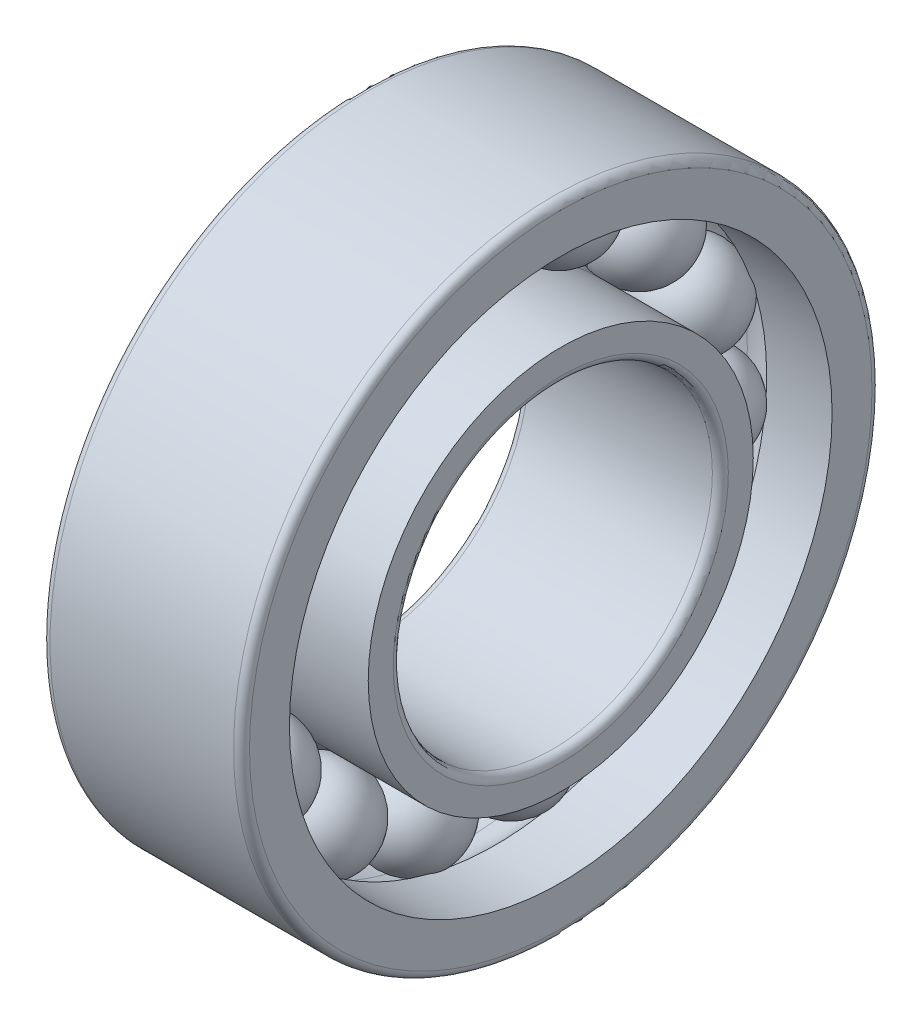
from build123d import *

# Parameters (mm, degrees)
CAGSPISKE_W         = 0.6
CAGSPISKE_H         = 0.4
CAGESPINE_ANGLE     = 0.001
BALLSDETAILED_COUNT = 15
BALLSDETAILED_ANGLE = 336


with BuildPart() as part:
    # CagSpiSke → CageSpine (revolve)
    with BuildSketch(Plane.XY):
        with Locations((0, 6)):
            Rectangle(CAGSPISKE_W, CAGSPISKE_H)
    revolve(axis=Axis((-20.6375, 0, 0), (1, 0, 0)), revolution_arc=CAGESPINE_ANGLE)

    # BalDetSke → BallDetailed (revolve)
    with BuildSketch(Plane.XY):
        with BuildLine():
            Line((-1.2, 6), (1.2, 6))
            ThreePointArc((1.2, 6), (0, 4.8), (-1.2, 6))
        make_face()
    balldetailed = revolve(axis=Axis((-1.905, 6, 0), (1, 0, 0)))

    # InnRacSke → InnerRace (revolve)
    with BuildSketch(Plane.XY):
        with BuildLine():
            Line((-0.860595724, 5.2), (-2.5, 5.2))
            Line((-2.5, 5.2), (-2.5, 4.2))
            ThreePointArc((-2.5, 4.2), (-2.441421356, 4.058578644), (-2.3, 4))
            Line((-2.3, 4), (2.3, 4))
            ThreePointArc((2.3, 4), (2.441421356, 4.058578644), (2.5, 4.2))
            Line((2.5, 4.2), (2.5, 4.825))
            Line((2.5, 4.825), (0, 4.825))
            ThreePointArc((0, 4.825), (-0.469374584, 4.922821974), (-0.860595724, 5.2))
        make_face()
    revolve(axis=Axis((-20.6375, 0, 0), (1, 0, 0)))

    # OutRacSke → OuterRace (revolve)
    with BuildSketch(Plane.XY):
        with BuildLine():
            Line((0, 7.175), (-2.5, 7.175))
            Line((-2.5, 7.175), (-2.5, 7.8))
            ThreePointArc((-2.5, 7.8), (-2.441421356, 7.941421356), (-2.3, 8))
            Line((-2.3, 8), (2.3, 8))
            ThreePointArc((2.3, 8), (2.441421356, 7.941421356), (2.5, 7.8))
            Line((2.5, 7.8), (2.5, 6.8))
            Line((2.5, 6.8), (0.860595724, 6.8))
            ThreePointArc((0.860595724, 6.8), (0.469374584, 7.077178026), (0, 7.175))
        make_face()
    revolve(axis=Axis((-20.6375, 0, 0), (1, 0, 0)))

    # BallsDetailed: BallDetailed ×15 about axis
    ballsdetailed_axis = Axis((-50, 0, 0), (1, 0, 0))
    for i in range(1, BALLSDETAILED_COUNT):
        add(balldetailed.rotate(ballsdetailed_axis, i * BALLSDETAILED_ANGLE / (BALLSDETAILED_COUNT - 1)))


solid = part.part
